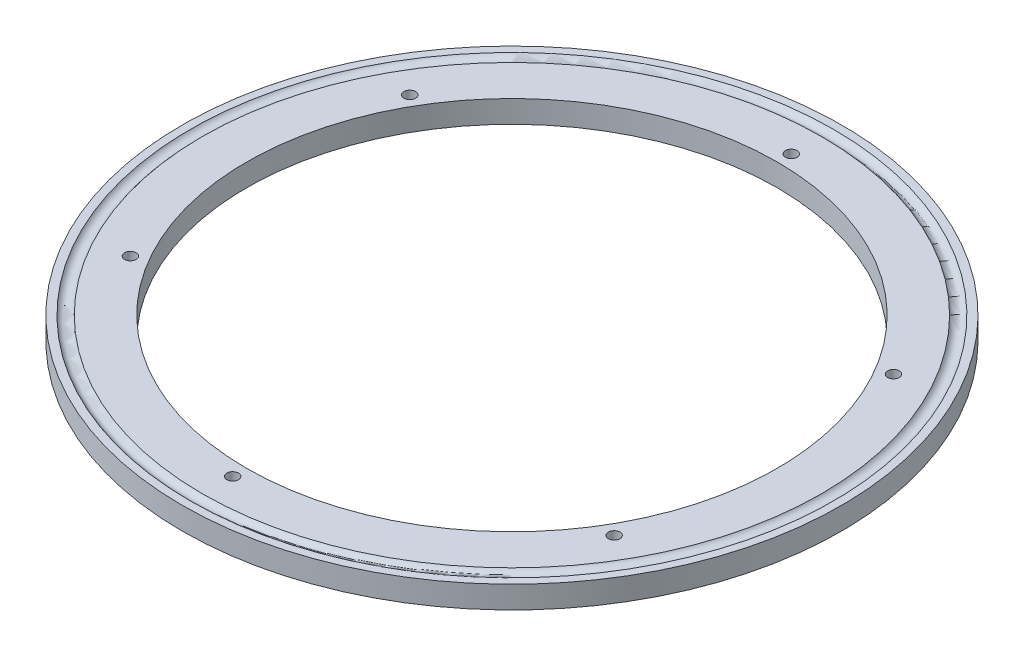
from build123d import *

# Parameters (mm, degrees)
SKETCH1_R           = 74.93
SKETCH1_R_2         = 1.3208
SKETCH1_R_3         = 60.325
BOSS_EXTRUDE1_DEPTH = 5.08


with BuildPart() as part:
    # Sketch1 → Boss-Extrude1 (new body)
    with BuildSketch(Plane(origin=(0, 0, 0), x_dir=(1, 0, 0), z_dir=(0, 1, 0))):
        Circle(SKETCH1_R)
        with Locations((0, 63.5)):
            Circle(SKETCH1_R_2, mode=Mode.SUBTRACT)
        with Locations((-54.99261314, -31.75)):
            Circle(SKETCH1_R_2, mode=Mode.SUBTRACT)
        with Locations((0, -63.5)):
            Circle(SKETCH1_R_2, mode=Mode.SUBTRACT)
        with Locations((54.99261314, -31.75)):
            Circle(SKETCH1_R_2, mode=Mode.SUBTRACT)
        with Locations((-54.99261314, 31.75)):
            Circle(SKETCH1_R_2, mode=Mode.SUBTRACT)
        Circle(SKETCH1_R_3, mode=Mode.SUBTRACT)
        with Locations((54.99261314, 31.75)):
            Circle(SKETCH1_R_2, mode=Mode.SUBTRACT)
    extrude(amount=BOSS_EXTRUDE1_DEPTH)

    # Sketch2 → Cut-Revolve1 (revolve, cut)
    with BuildSketch(Plane(origin=(0, 0, 0), x_dir=(0, 0, -1), z_dir=(1, 0, 0))):
        with BuildLine():
            ThreePointArc((73.146215296, 0), (71.755, 0.762), (70.363784704, 0))
            Line((70.363784704, 0), (73.146215296, 0))
        make_face()
        with BuildLine():
            ThreePointArc((70.363784704, 5.08), (71.755, 4.318), (73.146215296, 5.08))
            Line((73.146215296, 5.08), (70.363784704, 5.08))
        make_face()
    revolve(axis=Axis((0, 0, 0), (0, 1, 0)), mode=Mode.SUBTRACT)


solid = part.part
